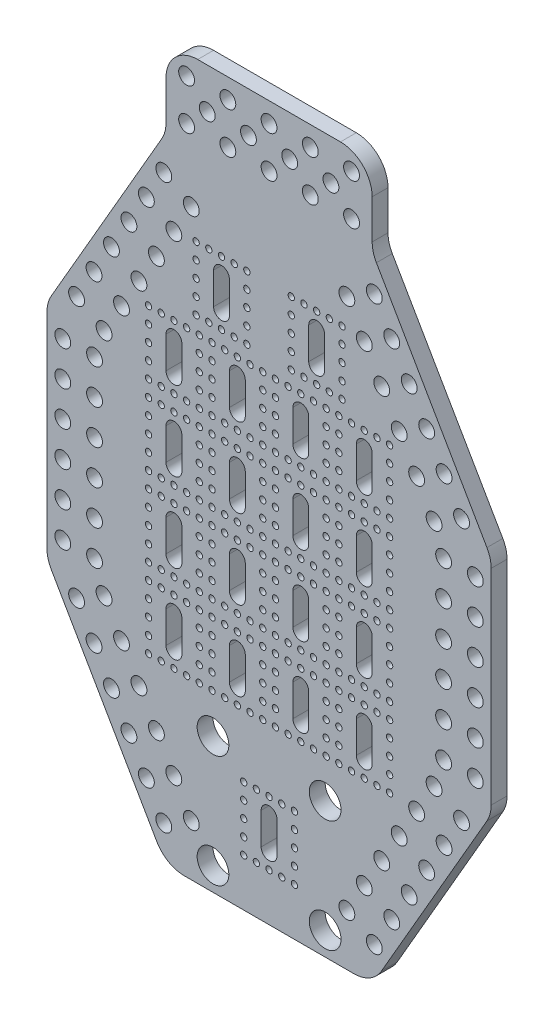
from build123d import *

# Parameters (mm, degrees)
BOSS_EXTRUDE1_DEPTH        = 2.5
SKETCH5_R                  = 1
CUT_EXTRUDE2_DEPTH         = 5
LPATTERN1_COUNT            = 4
LPATTERN1_PITCH            = 20
LPATTERN2_COPY_1_SKETCH_R  = 1
LPATTERN2_COPY_1_DEPTH     = 5
LPATTERN2_COPY_2_SKETCH_R  = 1
LPATTERN2_COPY_2_DEPTH     = 5
LPATTERN2_COPY_3_SKETCH_R  = 1
LPATTERN2_COPY_3_DEPTH     = 5
LPATTERN2_COPY_4_SKETCH_R  = 1
LPATTERN2_COPY_4_DEPTH     = 5
LPATTERN2_COPY_5_SKETCH_R  = 1
LPATTERN2_COPY_5_DEPTH     = 5
LPATTERN2_COPY_6_SKETCH_R  = 1
LPATTERN2_COPY_6_DEPTH     = 5
LPATTERN2_COPY_7_SKETCH_R  = 1
LPATTERN2_COPY_7_DEPTH     = 5
LPATTERN2_COPY_8_SKETCH_R  = 1
LPATTERN2_COPY_8_DEPTH     = 5
LPATTERN2_COPY_9_SKETCH_R  = 1
LPATTERN2_COPY_9_DEPTH     = 5
LPATTERN2_COPY_10_SKETCH_R = 1
LPATTERN2_COPY_10_DEPTH    = 5
LPATTERN2_COPY_11_SKETCH_R = 1
LPATTERN2_COPY_11_DEPTH    = 5
LPATTERN2_COPY_12_SKETCH_R = 1
LPATTERN2_COPY_12_DEPTH    = 5
SKETCH9_W                  = 65
SKETCH9_H                  = 25
BOSS_EXTRUDE6_DEPTH        = 5
SKETCH2_R                  = 2.5
CUT_EXTRUDE3_DEPTH         = 5
SKETCH13_R                 = 1
CUT_EXTRUDE5_DEPTH         = 5
FILLET4_R                  = 10
SKETCH3_R                  = 5
CUT_EXTRUDE6_DEPTH         = 5
SKETCH14_R                 = 1
CUT_EXTRUDE7_DEPTH         = 5
SKETCH12_R                 = 2.5
CUT_EXTRUDE8_DEPTH         = 5


with BuildPart() as part:
    # Sketch1 → Boss-Extrude1 (new, symmetric)
    with BuildSketch(Plane.XY):
        Polygon((32.5, 100), (-32.5, 100), (-70.027767497, 35), (-70.027767497, -35), (-32.5, -100), (32.5, -100), (70.027767497, -35), (70.027767497, 35), align=None)
    extrude(amount=BOSS_EXTRUDE1_DEPTH, both=True)

    # Sketch5 → Cut-Extrude2 (cut)
    with BuildSketch(Plane(origin=(0, 0, -2.5), x_dir=(-1, 0, 0), z_dir=(0, 0, -1))):
        with BuildLine():
            Line((27.5, 45), (27.5, 35))
            ThreePointArc((27.5, 35), (30, 32.5), (32.5, 35))
            Line((32.5, 35), (32.5, 45))
            ThreePointArc((32.5, 45), (30, 47.5), (27.5, 45))
        make_face()
        with Locations((38, 50)):
            Circle(SKETCH5_R)
        with Locations((38, 45)):
            Circle(SKETCH5_R)
        with Locations((38, 40)):
            Circle(SKETCH5_R)
        with Locations((38, 35)):
            Circle(SKETCH5_R)
        with Locations((38, 30)):
            Circle(SKETCH5_R)
        with Locations((22, 30)):
            Circle(SKETCH5_R)
        with Locations((22, 35)):
            Circle(SKETCH5_R)
        with Locations((22, 40)):
            Circle(SKETCH5_R)
        with Locations((22, 45)):
            Circle(SKETCH5_R)
        with Locations((22, 50)):
            Circle(SKETCH5_R)
        with Locations((34, 50)):
            Circle(SKETCH5_R)
        with Locations((30, 50)):
            Circle(SKETCH5_R)
        with Locations((26, 50)):
            Circle(SKETCH5_R)
        with Locations((34, 30)):
            Circle(SKETCH5_R)
        with Locations((30, 30)):
            Circle(SKETCH5_R)
        with Locations((26, 30)):
            Circle(SKETCH5_R)
    cut_extrude2 = extrude(amount=-CUT_EXTRUDE2_DEPTH, mode=Mode.SUBTRACT)

    # LPattern1: Cut-Extrude2 ×4
    with Locations(*[(i * LPATTERN1_PITCH, 0, 0) for i in range(1, LPATTERN1_COUNT)]):
        add(cut_extrude2, mode=Mode.SUBTRACT)

    # LPattern2 copy 1 sketch → LPattern2 copy 1 (cut)
    with BuildSketch(Plane(origin=(20, -25, -2.5), x_dir=(-1, 0, 0), z_dir=(0, 0, -1))):
        with BuildLine():
            Line((27.5, 45), (27.5, 35))
            ThreePointArc((27.5, 35), (30, 32.5), (32.5, 35))
            Line((32.5, 35), (32.5, 45))
            ThreePointArc((32.5, 45), (30, 47.5), (27.5, 45))
        make_face()
        with Locations((38, 50)):
            Circle(LPATTERN2_COPY_1_SKETCH_R)
        with Locations((38, 45)):
            Circle(LPATTERN2_COPY_1_SKETCH_R)
        with Locations((38, 40)):
            Circle(LPATTERN2_COPY_1_SKETCH_R)
        with Locations((38, 35)):
            Circle(LPATTERN2_COPY_1_SKETCH_R)
        with Locations((38, 30)):
            Circle(LPATTERN2_COPY_1_SKETCH_R)
        with Locations((22, 30)):
            Circle(LPATTERN2_COPY_1_SKETCH_R)
        with Locations((22, 35)):
            Circle(LPATTERN2_COPY_1_SKETCH_R)
        with Locations((22, 40)):
            Circle(LPATTERN2_COPY_1_SKETCH_R)
        with Locations((22, 45)):
            Circle(LPATTERN2_COPY_1_SKETCH_R)
        with Locations((22, 50)):
            Circle(LPATTERN2_COPY_1_SKETCH_R)
        with Locations((34, 50)):
            Circle(LPATTERN2_COPY_1_SKETCH_R)
        with Locations((30, 50)):
            Circle(LPATTERN2_COPY_1_SKETCH_R)
        with Locations((26, 50)):
            Circle(LPATTERN2_COPY_1_SKETCH_R)
        with Locations((34, 30)):
            Circle(LPATTERN2_COPY_1_SKETCH_R)
        with Locations((30, 30)):
            Circle(LPATTERN2_COPY_1_SKETCH_R)
        with Locations((26, 30)):
            Circle(LPATTERN2_COPY_1_SKETCH_R)
    extrude(amount=-LPATTERN2_COPY_1_DEPTH, mode=Mode.SUBTRACT)

    # LPattern2 copy 2 sketch → LPattern2 copy 2 (cut)
    with BuildSketch(Plane(origin=(20, -50, -2.5), x_dir=(-1, 0, 0), z_dir=(0, 0, -1))):
        with BuildLine():
            Line((27.5, 45), (27.5, 35))
            ThreePointArc((27.5, 35), (30, 32.5), (32.5, 35))
            Line((32.5, 35), (32.5, 45))
            ThreePointArc((32.5, 45), (30, 47.5), (27.5, 45))
        make_face()
        with Locations((38, 50)):
            Circle(LPATTERN2_COPY_2_SKETCH_R)
        with Locations((38, 45)):
            Circle(LPATTERN2_COPY_2_SKETCH_R)
        with Locations((38, 40)):
            Circle(LPATTERN2_COPY_2_SKETCH_R)
        with Locations((38, 35)):
            Circle(LPATTERN2_COPY_2_SKETCH_R)
        with Locations((38, 30)):
            Circle(LPATTERN2_COPY_2_SKETCH_R)
        with Locations((22, 30)):
            Circle(LPATTERN2_COPY_2_SKETCH_R)
        with Locations((22, 35)):
            Circle(LPATTERN2_COPY_2_SKETCH_R)
        with Locations((22, 40)):
            Circle(LPATTERN2_COPY_2_SKETCH_R)
        with Locations((22, 45)):
            Circle(LPATTERN2_COPY_2_SKETCH_R)
        with Locations((22, 50)):
            Circle(LPATTERN2_COPY_2_SKETCH_R)
        with Locations((34, 50)):
            Circle(LPATTERN2_COPY_2_SKETCH_R)
        with Locations((30, 50)):
            Circle(LPATTERN2_COPY_2_SKETCH_R)
        with Locations((26, 50)):
            Circle(LPATTERN2_COPY_2_SKETCH_R)
        with Locations((34, 30)):
            Circle(LPATTERN2_COPY_2_SKETCH_R)
        with Locations((30, 30)):
            Circle(LPATTERN2_COPY_2_SKETCH_R)
        with Locations((26, 30)):
            Circle(LPATTERN2_COPY_2_SKETCH_R)
    extrude(amount=-LPATTERN2_COPY_2_DEPTH, mode=Mode.SUBTRACT)

    # LPattern2 copy 3 sketch → LPattern2 copy 3 (cut)
    with BuildSketch(Plane(origin=(20, -75, -2.5), x_dir=(-1, 0, 0), z_dir=(0, 0, -1))):
        with BuildLine():
            Line((27.5, 45), (27.5, 35))
            ThreePointArc((27.5, 35), (30, 32.5), (32.5, 35))
            Line((32.5, 35), (32.5, 45))
            ThreePointArc((32.5, 45), (30, 47.5), (27.5, 45))
        make_face()
        with Locations((38, 50)):
            Circle(LPATTERN2_COPY_3_SKETCH_R)
        with Locations((38, 45)):
            Circle(LPATTERN2_COPY_3_SKETCH_R)
        with Locations((38, 40)):
            Circle(LPATTERN2_COPY_3_SKETCH_R)
        with Locations((38, 35)):
            Circle(LPATTERN2_COPY_3_SKETCH_R)
        with Locations((38, 30)):
            Circle(LPATTERN2_COPY_3_SKETCH_R)
        with Locations((22, 30)):
            Circle(LPATTERN2_COPY_3_SKETCH_R)
        with Locations((22, 35)):
            Circle(LPATTERN2_COPY_3_SKETCH_R)
        with Locations((22, 40)):
            Circle(LPATTERN2_COPY_3_SKETCH_R)
        with Locations((22, 45)):
            Circle(LPATTERN2_COPY_3_SKETCH_R)
        with Locations((22, 50)):
            Circle(LPATTERN2_COPY_3_SKETCH_R)
        with Locations((34, 50)):
            Circle(LPATTERN2_COPY_3_SKETCH_R)
        with Locations((30, 50)):
            Circle(LPATTERN2_COPY_3_SKETCH_R)
        with Locations((26, 50)):
            Circle(LPATTERN2_COPY_3_SKETCH_R)
        with Locations((34, 30)):
            Circle(LPATTERN2_COPY_3_SKETCH_R)
        with Locations((30, 30)):
            Circle(LPATTERN2_COPY_3_SKETCH_R)
        with Locations((26, 30)):
            Circle(LPATTERN2_COPY_3_SKETCH_R)
    extrude(amount=-LPATTERN2_COPY_3_DEPTH, mode=Mode.SUBTRACT)

    # LPattern2 copy 4 sketch → LPattern2 copy 4 (cut)
    with BuildSketch(Plane(origin=(40, -25, -2.5), x_dir=(-1, 0, 0), z_dir=(0, 0, -1))):
        with BuildLine():
            Line((27.5, 45), (27.5, 35))
            ThreePointArc((27.5, 35), (30, 32.5), (32.5, 35))
            Line((32.5, 35), (32.5, 45))
            ThreePointArc((32.5, 45), (30, 47.5), (27.5, 45))
        make_face()
        with Locations((38, 50)):
            Circle(LPATTERN2_COPY_4_SKETCH_R)
        with Locations((38, 45)):
            Circle(LPATTERN2_COPY_4_SKETCH_R)
        with Locations((38, 40)):
            Circle(LPATTERN2_COPY_4_SKETCH_R)
        with Locations((38, 35)):
            Circle(LPATTERN2_COPY_4_SKETCH_R)
        with Locations((38, 30)):
            Circle(LPATTERN2_COPY_4_SKETCH_R)
        with Locations((22, 30)):
            Circle(LPATTERN2_COPY_4_SKETCH_R)
        with Locations((22, 35)):
            Circle(LPATTERN2_COPY_4_SKETCH_R)
        with Locations((22, 40)):
            Circle(LPATTERN2_COPY_4_SKETCH_R)
        with Locations((22, 45)):
            Circle(LPATTERN2_COPY_4_SKETCH_R)
        with Locations((22, 50)):
            Circle(LPATTERN2_COPY_4_SKETCH_R)
        with Locations((34, 50)):
            Circle(LPATTERN2_COPY_4_SKETCH_R)
        with Locations((30, 50)):
            Circle(LPATTERN2_COPY_4_SKETCH_R)
        with Locations((26, 50)):
            Circle(LPATTERN2_COPY_4_SKETCH_R)
        with Locations((34, 30)):
            Circle(LPATTERN2_COPY_4_SKETCH_R)
        with Locations((30, 30)):
            Circle(LPATTERN2_COPY_4_SKETCH_R)
        with Locations((26, 30)):
            Circle(LPATTERN2_COPY_4_SKETCH_R)
    extrude(amount=-LPATTERN2_COPY_4_DEPTH, mode=Mode.SUBTRACT)

    # LPattern2 copy 5 sketch → LPattern2 copy 5 (cut)
    with BuildSketch(Plane(origin=(40, -50, -2.5), x_dir=(-1, 0, 0), z_dir=(0, 0, -1))):
        with BuildLine():
            Line((27.5, 45), (27.5, 35))
            ThreePointArc((27.5, 35), (30, 32.5), (32.5, 35))
            Line((32.5, 35), (32.5, 45))
            ThreePointArc((32.5, 45), (30, 47.5), (27.5, 45))
        make_face()
        with Locations((38, 50)):
            Circle(LPATTERN2_COPY_5_SKETCH_R)
        with Locations((38, 45)):
            Circle(LPATTERN2_COPY_5_SKETCH_R)
        with Locations((38, 40)):
            Circle(LPATTERN2_COPY_5_SKETCH_R)
        with Locations((38, 35)):
            Circle(LPATTERN2_COPY_5_SKETCH_R)
        with Locations((38, 30)):
            Circle(LPATTERN2_COPY_5_SKETCH_R)
        with Locations((22, 30)):
            Circle(LPATTERN2_COPY_5_SKETCH_R)
        with Locations((22, 35)):
            Circle(LPATTERN2_COPY_5_SKETCH_R)
        with Locations((22, 40)):
            Circle(LPATTERN2_COPY_5_SKETCH_R)
        with Locations((22, 45)):
            Circle(LPATTERN2_COPY_5_SKETCH_R)
        with Locations((22, 50)):
            Circle(LPATTERN2_COPY_5_SKETCH_R)
        with Locations((34, 50)):
            Circle(LPATTERN2_COPY_5_SKETCH_R)
        with Locations((30, 50)):
            Circle(LPATTERN2_COPY_5_SKETCH_R)
        with Locations((26, 50)):
            Circle(LPATTERN2_COPY_5_SKETCH_R)
        with Locations((34, 30)):
            Circle(LPATTERN2_COPY_5_SKETCH_R)
        with Locations((30, 30)):
            Circle(LPATTERN2_COPY_5_SKETCH_R)
        with Locations((26, 30)):
            Circle(LPATTERN2_COPY_5_SKETCH_R)
    extrude(amount=-LPATTERN2_COPY_5_DEPTH, mode=Mode.SUBTRACT)

    # LPattern2 copy 6 sketch → LPattern2 copy 6 (cut)
    with BuildSketch(Plane(origin=(40, -75, -2.5), x_dir=(-1, 0, 0), z_dir=(0, 0, -1))):
        with BuildLine():
            Line((27.5, 45), (27.5, 35))
            ThreePointArc((27.5, 35), (30, 32.5), (32.5, 35))
            Line((32.5, 35), (32.5, 45))
            ThreePointArc((32.5, 45), (30, 47.5), (27.5, 45))
        make_face()
        with Locations((38, 50)):
            Circle(LPATTERN2_COPY_6_SKETCH_R)
        with Locations((38, 45)):
            Circle(LPATTERN2_COPY_6_SKETCH_R)
        with Locations((38, 40)):
            Circle(LPATTERN2_COPY_6_SKETCH_R)
        with Locations((38, 35)):
            Circle(LPATTERN2_COPY_6_SKETCH_R)
        with Locations((38, 30)):
            Circle(LPATTERN2_COPY_6_SKETCH_R)
        with Locations((22, 30)):
            Circle(LPATTERN2_COPY_6_SKETCH_R)
        with Locations((22, 35)):
            Circle(LPATTERN2_COPY_6_SKETCH_R)
        with Locations((22, 40)):
            Circle(LPATTERN2_COPY_6_SKETCH_R)
        with Locations((22, 45)):
            Circle(LPATTERN2_COPY_6_SKETCH_R)
        with Locations((22, 50)):
            Circle(LPATTERN2_COPY_6_SKETCH_R)
        with Locations((34, 50)):
            Circle(LPATTERN2_COPY_6_SKETCH_R)
        with Locations((30, 50)):
            Circle(LPATTERN2_COPY_6_SKETCH_R)
        with Locations((26, 50)):
            Circle(LPATTERN2_COPY_6_SKETCH_R)
        with Locations((34, 30)):
            Circle(LPATTERN2_COPY_6_SKETCH_R)
        with Locations((30, 30)):
            Circle(LPATTERN2_COPY_6_SKETCH_R)
        with Locations((26, 30)):
            Circle(LPATTERN2_COPY_6_SKETCH_R)
    extrude(amount=-LPATTERN2_COPY_6_DEPTH, mode=Mode.SUBTRACT)

    # LPattern2 copy 7 sketch → LPattern2 copy 7 (cut)
    with BuildSketch(Plane(origin=(60, -25, -2.5), x_dir=(-1, 0, 0), z_dir=(0, 0, -1))):
        with BuildLine():
            Line((27.5, 45), (27.5, 35))
            ThreePointArc((27.5, 35), (30, 32.5), (32.5, 35))
            Line((32.5, 35), (32.5, 45))
            ThreePointArc((32.5, 45), (30, 47.5), (27.5, 45))
        make_face()
        with Locations((38, 50)):
            Circle(LPATTERN2_COPY_7_SKETCH_R)
        with Locations((38, 45)):
            Circle(LPATTERN2_COPY_7_SKETCH_R)
        with Locations((38, 40)):
            Circle(LPATTERN2_COPY_7_SKETCH_R)
        with Locations((38, 35)):
            Circle(LPATTERN2_COPY_7_SKETCH_R)
        with Locations((38, 30)):
            Circle(LPATTERN2_COPY_7_SKETCH_R)
        with Locations((22, 30)):
            Circle(LPATTERN2_COPY_7_SKETCH_R)
        with Locations((22, 35)):
            Circle(LPATTERN2_COPY_7_SKETCH_R)
        with Locations((22, 40)):
            Circle(LPATTERN2_COPY_7_SKETCH_R)
        with Locations((22, 45)):
            Circle(LPATTERN2_COPY_7_SKETCH_R)
        with Locations((22, 50)):
            Circle(LPATTERN2_COPY_7_SKETCH_R)
        with Locations((34, 50)):
            Circle(LPATTERN2_COPY_7_SKETCH_R)
        with Locations((30, 50)):
            Circle(LPATTERN2_COPY_7_SKETCH_R)
        with Locations((26, 50)):
            Circle(LPATTERN2_COPY_7_SKETCH_R)
        with Locations((34, 30)):
            Circle(LPATTERN2_COPY_7_SKETCH_R)
        with Locations((30, 30)):
            Circle(LPATTERN2_COPY_7_SKETCH_R)
        with Locations((26, 30)):
            Circle(LPATTERN2_COPY_7_SKETCH_R)
    extrude(amount=-LPATTERN2_COPY_7_DEPTH, mode=Mode.SUBTRACT)

    # LPattern2 copy 8 sketch → LPattern2 copy 8 (cut)
    with BuildSketch(Plane(origin=(60, -50, -2.5), x_dir=(-1, 0, 0), z_dir=(0, 0, -1))):
        with BuildLine():
            Line((27.5, 45), (27.5, 35))
            ThreePointArc((27.5, 35), (30, 32.5), (32.5, 35))
            Line((32.5, 35), (32.5, 45))
            ThreePointArc((32.5, 45), (30, 47.5), (27.5, 45))
        make_face()
        with Locations((38, 50)):
            Circle(LPATTERN2_COPY_8_SKETCH_R)
        with Locations((38, 45)):
            Circle(LPATTERN2_COPY_8_SKETCH_R)
        with Locations((38, 40)):
            Circle(LPATTERN2_COPY_8_SKETCH_R)
        with Locations((38, 35)):
            Circle(LPATTERN2_COPY_8_SKETCH_R)
        with Locations((38, 30)):
            Circle(LPATTERN2_COPY_8_SKETCH_R)
        with Locations((22, 30)):
            Circle(LPATTERN2_COPY_8_SKETCH_R)
        with Locations((22, 35)):
            Circle(LPATTERN2_COPY_8_SKETCH_R)
        with Locations((22, 40)):
            Circle(LPATTERN2_COPY_8_SKETCH_R)
        with Locations((22, 45)):
            Circle(LPATTERN2_COPY_8_SKETCH_R)
        with Locations((22, 50)):
            Circle(LPATTERN2_COPY_8_SKETCH_R)
        with Locations((34, 50)):
            Circle(LPATTERN2_COPY_8_SKETCH_R)
        with Locations((30, 50)):
            Circle(LPATTERN2_COPY_8_SKETCH_R)
        with Locations((26, 50)):
            Circle(LPATTERN2_COPY_8_SKETCH_R)
        with Locations((34, 30)):
            Circle(LPATTERN2_COPY_8_SKETCH_R)
        with Locations((30, 30)):
            Circle(LPATTERN2_COPY_8_SKETCH_R)
        with Locations((26, 30)):
            Circle(LPATTERN2_COPY_8_SKETCH_R)
    extrude(amount=-LPATTERN2_COPY_8_DEPTH, mode=Mode.SUBTRACT)

    # LPattern2 copy 9 sketch → LPattern2 copy 9 (cut)
    with BuildSketch(Plane(origin=(60, -75, -2.5), x_dir=(-1, 0, 0), z_dir=(0, 0, -1))):
        with BuildLine():
            Line((27.5, 45), (27.5, 35))
            ThreePointArc((27.5, 35), (30, 32.5), (32.5, 35))
            Line((32.5, 35), (32.5, 45))
            ThreePointArc((32.5, 45), (30, 47.5), (27.5, 45))
        make_face()
        with Locations((38, 50)):
            Circle(LPATTERN2_COPY_9_SKETCH_R)
        with Locations((38, 45)):
            Circle(LPATTERN2_COPY_9_SKETCH_R)
        with Locations((38, 40)):
            Circle(LPATTERN2_COPY_9_SKETCH_R)
        with Locations((38, 35)):
            Circle(LPATTERN2_COPY_9_SKETCH_R)
        with Locations((38, 30)):
            Circle(LPATTERN2_COPY_9_SKETCH_R)
        with Locations((22, 30)):
            Circle(LPATTERN2_COPY_9_SKETCH_R)
        with Locations((22, 35)):
            Circle(LPATTERN2_COPY_9_SKETCH_R)
        with Locations((22, 40)):
            Circle(LPATTERN2_COPY_9_SKETCH_R)
        with Locations((22, 45)):
            Circle(LPATTERN2_COPY_9_SKETCH_R)
        with Locations((22, 50)):
            Circle(LPATTERN2_COPY_9_SKETCH_R)
        with Locations((34, 50)):
            Circle(LPATTERN2_COPY_9_SKETCH_R)
        with Locations((30, 50)):
            Circle(LPATTERN2_COPY_9_SKETCH_R)
        with Locations((26, 50)):
            Circle(LPATTERN2_COPY_9_SKETCH_R)
        with Locations((34, 30)):
            Circle(LPATTERN2_COPY_9_SKETCH_R)
        with Locations((30, 30)):
            Circle(LPATTERN2_COPY_9_SKETCH_R)
        with Locations((26, 30)):
            Circle(LPATTERN2_COPY_9_SKETCH_R)
    extrude(amount=-LPATTERN2_COPY_9_DEPTH, mode=Mode.SUBTRACT)

    # LPattern2 copy 10 sketch → LPattern2 copy 10 (cut)
    with BuildSketch(Plane(origin=(0, -25, -2.5), x_dir=(-1, 0, 0), z_dir=(0, 0, -1))):
        with BuildLine():
            Line((27.5, 45), (27.5, 35))
            ThreePointArc((27.5, 35), (30, 32.5), (32.5, 35))
            Line((32.5, 35), (32.5, 45))
            ThreePointArc((32.5, 45), (30, 47.5), (27.5, 45))
        make_face()
        with Locations((38, 50)):
            Circle(LPATTERN2_COPY_10_SKETCH_R)
        with Locations((38, 45)):
            Circle(LPATTERN2_COPY_10_SKETCH_R)
        with Locations((38, 40)):
            Circle(LPATTERN2_COPY_10_SKETCH_R)
        with Locations((38, 35)):
            Circle(LPATTERN2_COPY_10_SKETCH_R)
        with Locations((38, 30)):
            Circle(LPATTERN2_COPY_10_SKETCH_R)
        with Locations((22, 30)):
            Circle(LPATTERN2_COPY_10_SKETCH_R)
        with Locations((22, 35)):
            Circle(LPATTERN2_COPY_10_SKETCH_R)
        with Locations((22, 40)):
            Circle(LPATTERN2_COPY_10_SKETCH_R)
        with Locations((22, 45)):
            Circle(LPATTERN2_COPY_10_SKETCH_R)
        with Locations((22, 50)):
            Circle(LPATTERN2_COPY_10_SKETCH_R)
        with Locations((34, 50)):
            Circle(LPATTERN2_COPY_10_SKETCH_R)
        with Locations((30, 50)):
            Circle(LPATTERN2_COPY_10_SKETCH_R)
        with Locations((26, 50)):
            Circle(LPATTERN2_COPY_10_SKETCH_R)
        with Locations((34, 30)):
            Circle(LPATTERN2_COPY_10_SKETCH_R)
        with Locations((30, 30)):
            Circle(LPATTERN2_COPY_10_SKETCH_R)
        with Locations((26, 30)):
            Circle(LPATTERN2_COPY_10_SKETCH_R)
    extrude(amount=-LPATTERN2_COPY_10_DEPTH, mode=Mode.SUBTRACT)

    # LPattern2 copy 11 sketch → LPattern2 copy 11 (cut)
    with BuildSketch(Plane(origin=(0, -50, -2.5), x_dir=(-1, 0, 0), z_dir=(0, 0, -1))):
        with BuildLine():
            Line((27.5, 45), (27.5, 35))
            ThreePointArc((27.5, 35), (30, 32.5), (32.5, 35))
            Line((32.5, 35), (32.5, 45))
            ThreePointArc((32.5, 45), (30, 47.5), (27.5, 45))
        make_face()
        with Locations((38, 50)):
            Circle(LPATTERN2_COPY_11_SKETCH_R)
        with Locations((38, 45)):
            Circle(LPATTERN2_COPY_11_SKETCH_R)
        with Locations((38, 40)):
            Circle(LPATTERN2_COPY_11_SKETCH_R)
        with Locations((38, 35)):
            Circle(LPATTERN2_COPY_11_SKETCH_R)
        with Locations((38, 30)):
            Circle(LPATTERN2_COPY_11_SKETCH_R)
        with Locations((22, 30)):
            Circle(LPATTERN2_COPY_11_SKETCH_R)
        with Locations((22, 35)):
            Circle(LPATTERN2_COPY_11_SKETCH_R)
        with Locations((22, 40)):
            Circle(LPATTERN2_COPY_11_SKETCH_R)
        with Locations((22, 45)):
            Circle(LPATTERN2_COPY_11_SKETCH_R)
        with Locations((22, 50)):
            Circle(LPATTERN2_COPY_11_SKETCH_R)
        with Locations((34, 50)):
            Circle(LPATTERN2_COPY_11_SKETCH_R)
        with Locations((30, 50)):
            Circle(LPATTERN2_COPY_11_SKETCH_R)
        with Locations((26, 50)):
            Circle(LPATTERN2_COPY_11_SKETCH_R)
        with Locations((34, 30)):
            Circle(LPATTERN2_COPY_11_SKETCH_R)
        with Locations((30, 30)):
            Circle(LPATTERN2_COPY_11_SKETCH_R)
        with Locations((26, 30)):
            Circle(LPATTERN2_COPY_11_SKETCH_R)
    extrude(amount=-LPATTERN2_COPY_11_DEPTH, mode=Mode.SUBTRACT)

    # LPattern2 copy 12 sketch → LPattern2 copy 12 (cut)
    with BuildSketch(Plane(origin=(0, -75, -2.5), x_dir=(-1, 0, 0), z_dir=(0, 0, -1))):
        with BuildLine():
            Line((27.5, 45), (27.5, 35))
            ThreePointArc((27.5, 35), (30, 32.5), (32.5, 35))
            Line((32.5, 35), (32.5, 45))
            ThreePointArc((32.5, 45), (30, 47.5), (27.5, 45))
        make_face()
        with Locations((38, 50)):
            Circle(LPATTERN2_COPY_12_SKETCH_R)
        with Locations((38, 45)):
            Circle(LPATTERN2_COPY_12_SKETCH_R)
        with Locations((38, 40)):
            Circle(LPATTERN2_COPY_12_SKETCH_R)
        with Locations((38, 35)):
            Circle(LPATTERN2_COPY_12_SKETCH_R)
        with Locations((38, 30)):
            Circle(LPATTERN2_COPY_12_SKETCH_R)
        with Locations((22, 30)):
            Circle(LPATTERN2_COPY_12_SKETCH_R)
        with Locations((22, 35)):
            Circle(LPATTERN2_COPY_12_SKETCH_R)
        with Locations((22, 40)):
            Circle(LPATTERN2_COPY_12_SKETCH_R)
        with Locations((22, 45)):
            Circle(LPATTERN2_COPY_12_SKETCH_R)
        with Locations((22, 50)):
            Circle(LPATTERN2_COPY_12_SKETCH_R)
        with Locations((34, 50)):
            Circle(LPATTERN2_COPY_12_SKETCH_R)
        with Locations((30, 50)):
            Circle(LPATTERN2_COPY_12_SKETCH_R)
        with Locations((26, 50)):
            Circle(LPATTERN2_COPY_12_SKETCH_R)
        with Locations((34, 30)):
            Circle(LPATTERN2_COPY_12_SKETCH_R)
        with Locations((30, 30)):
            Circle(LPATTERN2_COPY_12_SKETCH_R)
        with Locations((26, 30)):
            Circle(LPATTERN2_COPY_12_SKETCH_R)
    extrude(amount=-LPATTERN2_COPY_12_DEPTH, mode=Mode.SUBTRACT)

    # Sketch9 → Boss-Extrude6 (add)
    with BuildSketch(Plane(origin=(0, 0, -2.5), x_dir=(-1, 0, 0), z_dir=(0, 0, -1))):
        with Locations((0, 112.5)):
            Rectangle(SKETCH9_W, SKETCH9_H)
    extrude(amount=-BOSS_EXTRUDE6_DEPTH)

    # Sketch2 → Cut-Extrude3 (cut)
    with BuildSketch(Plane(origin=(0, 0, -2.5), x_dir=(-1, 0, 0), z_dir=(0, 0, -1))):
        with Locations((-35.523502692, 64.763139721)):
            Circle(SKETCH2_R)
        with Locations((-44.18375673, 69.763139721)):
            Circle(SKETCH2_R)
        with Locations((-41.023502692, 55.236860279)):
            Circle(SKETCH2_R)
        with Locations((-49.68375673, 60.236860279)):
            Circle(SKETCH2_R)
        with Locations((49.68375673, 60.236860279)):
            Circle(SKETCH2_R)
        with Locations((41.023502692, 55.236860279)):
            Circle(SKETCH2_R)
        with Locations((44.18375673, 69.763139721)):
            Circle(SKETCH2_R)
        with Locations((35.523502692, 64.763139721)):
            Circle(SKETCH2_R)
        with Locations((-55.027767497, 5.5)):
            Circle(SKETCH2_R)
        with Locations((-55.027767497, -5.5)):
            Circle(SKETCH2_R)
        with Locations((-65.027767497, -5.5)):
            Circle(SKETCH2_R)
        with Locations((-65.027767497, 5.5)):
            Circle(SKETCH2_R)
        with Locations((65.027767497, 5.5)):
            Circle(SKETCH2_R)
        with Locations((65.027767497, -5.5)):
            Circle(SKETCH2_R)
        with Locations((55.027767497, -5.5)):
            Circle(SKETCH2_R)
        with Locations((55.027767497, 5.5)):
            Circle(SKETCH2_R)
        with Locations((35.523502692, -64.763139721)):
            Circle(SKETCH2_R)
        with Locations((44.18375673, -69.763139721)):
            Circle(SKETCH2_R)
        with Locations((41.023502692, -55.236860279)):
            Circle(SKETCH2_R)
        with Locations((49.68375673, -60.236860279)):
            Circle(SKETCH2_R)
        with Locations((-49.68375673, -60.236860279)):
            Circle(SKETCH2_R)
        with Locations((-41.023502692, -55.236860279)):
            Circle(SKETCH2_R)
        with Locations((-44.18375673, -69.763139721)):
            Circle(SKETCH2_R)
        with Locations((-35.523502692, -64.763139721)):
            Circle(SKETCH2_R)
        with Locations((-24.523502692, 83.815698604)):
            Circle(SKETCH2_R)
        with Locations((-30.023502692, 74.289419162)):
            Circle(SKETCH2_R)
        with Locations((-38.68375673, 79.289419162)):
            Circle(SKETCH2_R)
        with Locations((-33.18375673, 88.815698604)):
            Circle(SKETCH2_R)
        with Locations((-55.18375673, 50.710580838)):
            Circle(SKETCH2_R)
        with Locations((-46.523502692, 45.710580838)):
            Circle(SKETCH2_R)
        with Locations((-52.023502692, 36.184301396)):
            Circle(SKETCH2_R)
        with Locations((-60.68375673, 41.184301396)):
            Circle(SKETCH2_R)
        with Locations((-55.027767497, 27.5)):
            Circle(SKETCH2_R)
        with Locations((-65.027767497, 27.5)):
            Circle(SKETCH2_R)
        with Locations((-55.027767497, 16.5)):
            Circle(SKETCH2_R)
        with Locations((-65.027767497, 16.5)):
            Circle(SKETCH2_R)
        with Locations((-55.027767497, -16.5)):
            Circle(SKETCH2_R)
        with Locations((-65.027767497, -16.5)):
            Circle(SKETCH2_R)
        with Locations((-55.027767497, -27.5)):
            Circle(SKETCH2_R)
        with Locations((-65.027767497, -27.5)):
            Circle(SKETCH2_R)
        with Locations((-52.023502692, -36.184301396)):
            Circle(SKETCH2_R)
        with Locations((-60.68375673, -41.184301396)):
            Circle(SKETCH2_R)
        with Locations((-46.523502692, -45.710580838)):
            Circle(SKETCH2_R)
        with Locations((-55.18375673, -50.710580838)):
            Circle(SKETCH2_R)
        with Locations((-30.023502692, -74.289419162)):
            Circle(SKETCH2_R)
        with Locations((-24.523502692, -83.815698604)):
            Circle(SKETCH2_R)
        with Locations((-38.68375673, -79.289419162)):
            Circle(SKETCH2_R)
        with Locations((-33.18375673, -88.815698604)):
            Circle(SKETCH2_R)
        with Locations((33.18375673, -88.815698604)):
            Circle(SKETCH2_R)
        with Locations((38.68375673, -79.289419162)):
            Circle(SKETCH2_R)
        with Locations((24.523502692, -83.815698604)):
            Circle(SKETCH2_R)
        with Locations((30.023502692, -74.289419162)):
            Circle(SKETCH2_R)
        with Locations((55.18375673, -50.710580838)):
            Circle(SKETCH2_R)
        with Locations((46.523502692, -45.710580838)):
            Circle(SKETCH2_R)
        with Locations((60.68375673, -41.184301396)):
            Circle(SKETCH2_R)
        with Locations((52.023502692, -36.184301396)):
            Circle(SKETCH2_R)
        with Locations((65.027767497, -27.5)):
            Circle(SKETCH2_R)
        with Locations((55.027767497, -27.5)):
            Circle(SKETCH2_R)
        with Locations((65.027767497, -16.5)):
            Circle(SKETCH2_R)
        with Locations((55.027767497, -16.5)):
            Circle(SKETCH2_R)
        with Locations((65.027767497, 16.5)):
            Circle(SKETCH2_R)
        with Locations((55.027767497, 16.5)):
            Circle(SKETCH2_R)
        with Locations((65.027767497, 27.5)):
            Circle(SKETCH2_R)
        with Locations((55.027767497, 27.5)):
            Circle(SKETCH2_R)
        with Locations((60.68375673, 41.184301396)):
            Circle(SKETCH2_R)
        with Locations((52.023502692, 36.184301396)):
            Circle(SKETCH2_R)
        with Locations((46.523502692, 45.710580838)):
            Circle(SKETCH2_R)
        with Locations((55.18375673, 50.710580838)):
            Circle(SKETCH2_R)
        with Locations((33.18375673, 88.815698604)):
            Circle(SKETCH2_R)
        with Locations((38.68375673, 79.289419162)):
            Circle(SKETCH2_R)
        with Locations((30.023502692, 74.289419162)):
            Circle(SKETCH2_R)
        with Locations((24.523502692, 83.815698604)):
            Circle(SKETCH2_R)
    extrude(amount=-CUT_EXTRUDE3_DEPTH, mode=Mode.SUBTRACT)

    # Sketch13 → Cut-Extrude5 (cut)
    with BuildSketch(Plane(origin=(0, 0, -2.5), x_dir=(-1, 0, 0), z_dir=(0, 0, -1))):
        with BuildLine():
            Line((12.5, 70), (12.5, 60))
            ThreePointArc((12.5, 60), (15, 57.5), (17.5, 60))
            Line((17.5, 60), (17.5, 70))
            ThreePointArc((17.5, 70), (15, 72.5), (12.5, 70))
        make_face()
        with BuildLine():
            Line((-17.5, 70), (-17.5, 60))
            ThreePointArc((-17.5, 60), (-15, 57.5), (-12.5, 60))
            Line((-12.5, 60), (-12.5, 70))
            ThreePointArc((-12.5, 70), (-15, 72.5), (-17.5, 70))
        make_face()
        with Locations((23, 75)):
            Circle(SKETCH13_R)
        with Locations((23, 70)):
            Circle(SKETCH13_R)
        with Locations((23, 65)):
            Circle(SKETCH13_R)
        with Locations((23, 60)):
            Circle(SKETCH13_R)
        with Locations((23, 55)):
            Circle(SKETCH13_R)
        with Locations((7, 55)):
            Circle(SKETCH13_R)
        with Locations((7, 60)):
            Circle(SKETCH13_R)
        with Locations((7, 65)):
            Circle(SKETCH13_R)
        with Locations((7, 70)):
            Circle(SKETCH13_R)
        with Locations((7, 75)):
            Circle(SKETCH13_R)
        with Locations((19, 75)):
            Circle(SKETCH13_R)
        with Locations((15, 75)):
            Circle(SKETCH13_R)
        with Locations((11, 75)):
            Circle(SKETCH13_R)
        with Locations((19, 55)):
            Circle(SKETCH13_R)
        with Locations((15, 55)):
            Circle(SKETCH13_R)
        with Locations((11, 55)):
            Circle(SKETCH13_R)
        with Locations((-11, 55)):
            Circle(SKETCH13_R)
        with Locations((-15, 55)):
            Circle(SKETCH13_R)
        with Locations((-19, 55)):
            Circle(SKETCH13_R)
        with Locations((-11, 75)):
            Circle(SKETCH13_R)
        with Locations((-15, 75)):
            Circle(SKETCH13_R)
        with Locations((-19, 75)):
            Circle(SKETCH13_R)
        with Locations((-7, 75)):
            Circle(SKETCH13_R)
        with Locations((-7, 70)):
            Circle(SKETCH13_R)
        with Locations((-7, 65)):
            Circle(SKETCH13_R)
        with Locations((-7, 60)):
            Circle(SKETCH13_R)
        with Locations((-7, 55)):
            Circle(SKETCH13_R)
        with Locations((-23, 55)):
            Circle(SKETCH13_R)
        with Locations((-23, 60)):
            Circle(SKETCH13_R)
        with Locations((-23, 65)):
            Circle(SKETCH13_R)
        with Locations((-23, 70)):
            Circle(SKETCH13_R)
        with Locations((-23, 75)):
            Circle(SKETCH13_R)
    extrude(amount=-CUT_EXTRUDE5_DEPTH, mode=Mode.SUBTRACT)

    # Fillet4
    fillet4_edges = [part.edges().sort_by_distance(p)[0] for p in [
        (70.027767497, -35, 0),
        (-32.5, -100, 0),
        (32.5, -100, 0),
        (-70.027767497, -35, 0),
        (-70.027767497, 35, 0),
        (70.027767497, 35, 0),
        (32.5, 100, 0),
        (-32.5, 100, 0),
        (-32.5, 125, 0),
        (32.5, 125, 0),
    ]]
    fillet(fillet4_edges, radius=FILLET4_R)

    # Sketch3 → Cut-Extrude6 (cut)
    with BuildSketch(Plane(origin=(0, 0, -2.5), x_dir=(-1, 0, 0), z_dir=(0, 0, -1))):
        with Locations((17.67766953, -57.32233047)):
            Circle(SKETCH3_R)
        with Locations((-17.67766953, -57.32233047)):
            Circle(SKETCH3_R)
        with Locations((17.67766953, -92.67766953)):
            Circle(SKETCH3_R)
        with Locations((-17.67766953, -92.67766953)):
            Circle(SKETCH3_R)
    extrude(amount=-CUT_EXTRUDE6_DEPTH, mode=Mode.SUBTRACT)

    # Sketch14 → Cut-Extrude7 (cut)
    with BuildSketch(Plane(origin=(0, 0, -2.5), x_dir=(-1, 0, 0), z_dir=(0, 0, -1))):
        with BuildLine():
            Line((-2.5, -70), (-2.5, -80))
            ThreePointArc((-2.5, -80), (0, -82.5), (2.5, -80))
            Line((2.5, -80), (2.5, -70))
            ThreePointArc((2.5, -70), (0, -67.5), (-2.5, -70))
        make_face()
        with Locations((8, -65)):
            Circle(SKETCH14_R)
        with Locations((8, -70)):
            Circle(SKETCH14_R)
        with Locations((8, -75)):
            Circle(SKETCH14_R)
        with Locations((8, -80)):
            Circle(SKETCH14_R)
        with Locations((8, -85)):
            Circle(SKETCH14_R)
        with Locations((-8, -85)):
            Circle(SKETCH14_R)
        with Locations((-8, -80)):
            Circle(SKETCH14_R)
        with Locations((-8, -75)):
            Circle(SKETCH14_R)
        with Locations((-8, -70)):
            Circle(SKETCH14_R)
        with Locations((-8, -65)):
            Circle(SKETCH14_R)
        with Locations((4, -65)):
            Circle(SKETCH14_R)
        with Locations((0, -65)):
            Circle(SKETCH14_R)
        with Locations((-4, -65)):
            Circle(SKETCH14_R)
        with Locations((4, -85)):
            Circle(SKETCH14_R)
        with Locations((0, -85)):
            Circle(SKETCH14_R)
        with Locations((-4, -85)):
            Circle(SKETCH14_R)
    extrude(amount=-CUT_EXTRUDE7_DEPTH, mode=Mode.SUBTRACT)

    # Sketch12 → Cut-Extrude8 (cut)
    with BuildSketch(Plane(origin=(0, 0, -2.5), x_dir=(-1, 0, 0), z_dir=(0, 0, -1))):
        with Locations((-26, 118.75)):
            Circle(SKETCH12_R)
        with Locations((-26, 105.75)):
            Circle(SKETCH12_R)
        with Locations((-13, 118.75)):
            Circle(SKETCH12_R)
        with Locations((-13, 105.75)):
            Circle(SKETCH12_R)
        with Locations((0, 118.75)):
            Circle(SKETCH12_R)
        with Locations((0, 105.75)):
            Circle(SKETCH12_R)
        with Locations((13, 118.75)):
            Circle(SKETCH12_R)
        with Locations((13, 105.75)):
            Circle(SKETCH12_R)
        with Locations((26, 118.75)):
            Circle(SKETCH12_R)
        with Locations((26, 105.75)):
            Circle(SKETCH12_R)
        with Locations((-19.5, 112.25)):
            Circle(SKETCH12_R)
        with Locations((-6.5, 112.25)):
            Circle(SKETCH12_R)
        with Locations((6.5, 112.25)):
            Circle(SKETCH12_R)
        with Locations((19.5, 112.25)):
            Circle(SKETCH12_R)
    extrude(amount=-CUT_EXTRUDE8_DEPTH, mode=Mode.SUBTRACT)


solid = part.part
